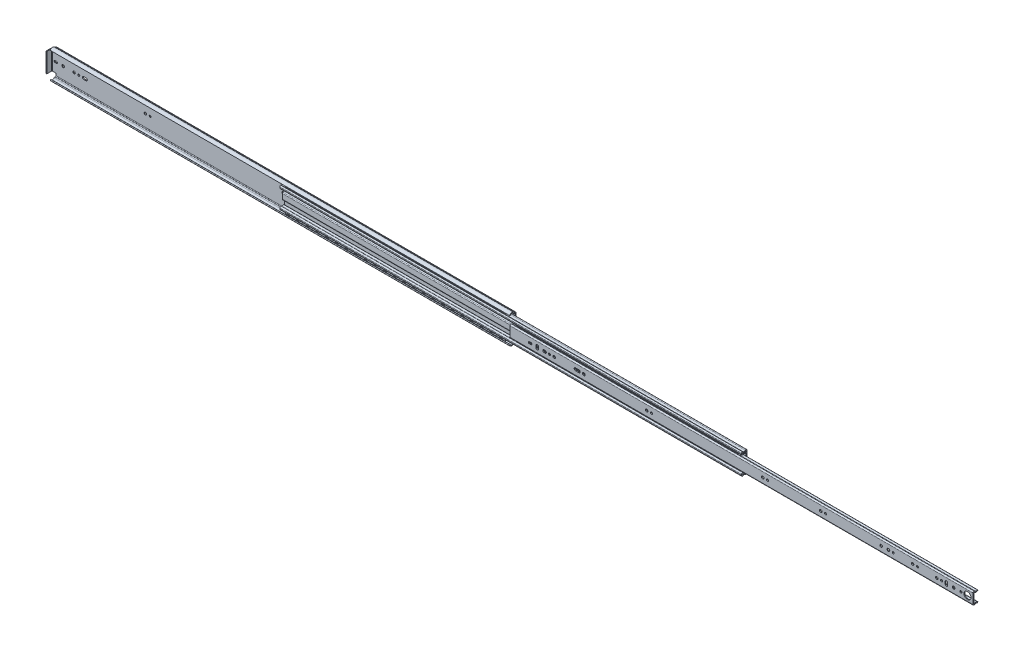
from build123d import *
from build123d.topology import SkipClean

# Parameters (mm, degrees)
EXTRUDE_THIN1_START     = -609.6
EXTRUDE_THIN1_DEPTH     = 1219.2
EXTRUDE_THIN2_DEPTH     = 1212.85
EXTRUDE_THIN5_START     = -1216.66
EXTRUDE_THIN5_DEPTH     = 1216.66
CUT_EXTRUDE1_DEPTH      = 1830.230661576
CUT_EXTRUDE1_DEPTH_BACK = 1830.230661576
SKETCH6_W               = 12.7
SKETCH6_H               = 12.7
SKETCH9_W               = 2.3622
SKETCH9_H               = 13.3858
EXTRUDE1_DEPTH          = 25.4
FILLET1_R               = 1.016
FILLET2_R               = 3.3782
CUT_EXTRUDE2_DEPTH      = 2.3622
SKETCH2_R               = 2.5781
SKETCH2_R_2             = 3.302
CUT_EXTRUDE12_DEPTH     = 2.3622
SKETCH22_R              = 2.5781
SKETCH22_R_2            = 3.302
SKETCH22_R_3            = 3.5687
CUT_EXTRUDE13_DEPTH     = 2.3622
SKETCH23_R              = 2.5781
SKETCH23_R_2            = 3.302
CUT_EXTRUDE14_DEPTH     = 2.3622
SKETCH24_R              = 2.5781
SKETCH24_R_2            = 3.302
CUT_EXTRUDE15_DEPTH     = 2.3622
SKETCH25_R              = 2.5781
SKETCH25_R_2            = 3.302
CUT_EXTRUDE16_DEPTH     = 2.3622
SKETCH27_R              = 3.5687
CUT_E_DEPTH             = 2.3622
SKETCH28_R              = 3.302
CUT_F_DEPTH             = 2.3622
SKETCH29_R              = 2.5781
CUT_EXTRUDE18_DEPTH     = 2.3622
CUT_H_DEPTH             = 2.3622
CUT_J_DEPTH             = 2.3622
SKETCH32_R              = 2.5781
SKETCH32_R_2            = 3.302
CUT_EXTRUDE21_DEPTH     = 2.3622
SKETCH210_R             = 2.5781
SKETCH210_R_2           = 3.302
CUT_EXTRUDE19_DEPTH     = 2.3622
SKETCH211_R             = 2.5781
SKETCH211_R_2           = 3.302
CUT_EXTRUDE110_DEPTH    = 2.3622
SKETCH212_R             = 2.5781
SKETCH212_R_2           = 3.302
CUT_EXTRUDE111_DEPTH    = 2.3622
SKETCH214_R             = 2.5781
SKETCH214_R_2           = 3.302
CUT_EXTRUDE113_DEPTH    = 2.3622
SKETCH215_R             = 3.302
CUT_EXTRUDE114_DEPTH    = 2.3622
CUT_R_DEPTH             = 2.3622
LPATTERN1_COUNT         = 23
LPATTERN1_PITCH         = 25.4
EXTRUDE2_DEPTH          = 12.7
EXTRUDE2_DEPTH_BACK     = 565.15
SKETCH218_W             = 11.43
SKETCH218_H             = 1.27
LPATTERN2_COUNT         = 23
LPATTERN2_PITCH         = 25.4
EXTRUDE3_DEPTH          = 12.7
EXTRUDE3_DEPTH_BACK     = 568.96
SKETCH220_W             = 9.245599771
SKETCH220_H             = 1.27


# Read off the part's stored shape, not the designer's step: Extrude-Thin1, Extrude-Thin5
with BuildPart() as part:
    # Extrude-Thin1 outline → Extrude-Thin1 (new body)
    with BuildSketch(Plane(origin=(0, 0, 0), x_dir=(0, 0, -1), z_dir=(1, 0, 0)).offset(EXTRUDE_THIN1_START)):
        with BuildLine():
            ThreePointArc((5.752462483, 35.334775085), (-0.647910774, 38.071449668), (-6.469678085, 34.255536805))
            Line((-6.469678085, 34.255536805), (-4.394919251, 33.126216382))
            ThreePointArc((-4.394919251, 33.126216382), (-0.440132491, 35.718405464), (3.907707273, 33.85935411))
            ThreePointArc((3.907707273, 33.85935411), (4.993998236, 32.994951487), (6.347544809, 32.686517335))
            Line((6.347544809, 32.686517335), (7.175193262, 32.686517335))
            ThreePointArc((7.175193262, 32.686517335), (8.297725277, 32.22154935), (8.762693262, 31.099017335))
            Line((8.762693262, 31.099017335), (8.762693262, 0))
            Line((8.762693262, 0), (11.124893262, 0))
            Line((11.124893262, 0), (11.124893262, 31.099017335))
            ThreePointArc((11.124893262, 31.099017335), (9.968052916, 33.891876989), (7.175193262, 35.048717335))
            Line((7.175193262, 35.048717335), (6.347544809, 35.048717335))
            ThreePointArc((6.347544809, 35.048717335), (6.017411498, 35.123945177), (5.752462483, 35.334775085))
        make_face()
    extrude(amount=EXTRUDE_THIN1_DEPTH)

    # Sketch6 → Cut-Extrude1 (cut, two sides: drawn at the far end of the back side and taken through both)
    with BuildSketch(Plane.XY.offset(-CUT_EXTRUDE1_DEPTH_BACK)):
        with Locations((-603.25, 31.75)):
            Rectangle(SKETCH6_W, SKETCH6_H)
    extrude(amount=CUT_EXTRUDE1_DEPTH + CUT_EXTRUDE1_DEPTH_BACK, mode=Mode.SUBTRACT)

    # Sketch9 → Extrude1 (add)
    with BuildSketch(Plane(origin=(0, 25.4, 0), x_dir=(-1, 0, 0), z_dir=(0, 1, 0))):
        with Locations((608.4189, -2.069793262)):
            Rectangle(SKETCH9_W, SKETCH9_H)
    extrude(amount=-EXTRUDE1_DEPTH)

    # Fillet1
    fillet1_edges = [part.edges().sort_by_distance(p)[0] for p in [
        (-607.2378, 12.7, -8.762693262),
    ]]
    fillet(fillet1_edges, radius=FILLET1_R)

    # Fillet2
    fillet2_edges = [part.edges().sort_by_distance(p)[0] for p in [
        (-609.6, 12.7, -11.124893262),
    ]]
    fillet(fillet2_edges, radius=FILLET2_R)

    # Sketch32 → Cut-Extrude21 (cut)
    with BuildSketch(Plane.XY.offset(-8.762693262)):
        with Locations((596.9, 0)):
            Circle(SKETCH32_R)
        with Locations((577.85, 0)):
            Circle(SKETCH32_R_2)
        with Locations((520.7, 0)):
            Circle(SKETCH32_R_2)
        with Locations((533.4, 0)):
            Circle(SKETCH32_R)
        with BuildLine():
            Line((549.148, 0), (561.848, 0))
            ThreePointArc((561.848, 0), (560.880866591, 2.334866591), (558.546, 3.302))
            Line((558.546, 3.302), (552.45, 3.302))
            ThreePointArc((552.45, 3.302), (550.115133409, 2.334866591), (549.148, 0))
        make_face()
    extrude(amount=-CUT_EXTRUDE21_DEPTH, mode=Mode.SUBTRACT)

    # Sketch210 → Cut-Extrude19 (cut)
    with BuildSketch(Plane(origin=(-677.249248887, 14.903736783, -8.762693262), x_dir=(1, 0, 0), z_dir=(0, 0, 1))):
        with Locations((1051.899248887, -14.903736783)):
            Circle(SKETCH210_R)
        with Locations((1039.199248887, -14.903736783)):
            Circle(SKETCH210_R_2)
    extrude(amount=-CUT_EXTRUDE19_DEPTH, mode=Mode.SUBTRACT)

    # Sketch211 → Cut-Extrude110 (cut)
    with BuildSketch(Plane(origin=(-447.985498291, 15.81613418, -8.762693262), x_dir=(1, 0, 0), z_dir=(0, 0, 1))):
        with Locations((460.685498291, -15.81613418)):
            Circle(SKETCH211_R)
        with Locations((447.985498291, -15.81613418)):
            Circle(SKETCH211_R_2)
    extrude(amount=-CUT_EXTRUDE110_DEPTH, mode=Mode.SUBTRACT)

    # Sketch212 → Cut-Extrude111 (cut)
    with BuildSketch(Plane(origin=(250.194594693, 14.477181682, -8.762693262), x_dir=(1, 0, 0), z_dir=(0, 0, 1))):
        with Locations((-599.444594693, -14.477181682)):
            Circle(SKETCH212_R)
        with Locations((-612.144594693, -14.477181682)):
            Circle(SKETCH212_R_2)
    extrude(amount=-CUT_EXTRUDE111_DEPTH, mode=Mode.SUBTRACT)

    # Sketch214 → Cut-Extrude113 (cut)
    with BuildSketch(Plane(origin=(529.798432462, 18.139402612, -8.762693262), x_dir=(1, 0, 0), z_dir=(0, 0, 1))):
        with Locations((-1066.500432462, -18.139402612)):
            Circle(SKETCH214_R)
        with Locations((-1079.200432462, -18.139402612)):
            Circle(SKETCH214_R_2)
        with BuildLine():
            Line((-1044.148432462, -18.139402612), (-1056.848432462, -18.139402612))
            ThreePointArc((-1056.848432462, -18.139402612), (-1055.881299054, -15.80453602), (-1053.546432462, -14.837402612))
            Line((-1053.546432462, -14.837402612), (-1047.450432462, -14.837402612))
            ThreePointArc((-1047.450432462, -14.837402612), (-1045.115565871, -15.80453602), (-1044.148432462, -18.139402612))
        make_face()
    extrude(amount=-CUT_EXTRUDE113_DEPTH, mode=Mode.SUBTRACT)

    # Sketch215 → Cut-Extrude114 (cut)
    with BuildSketch(Plane(origin=(674.3557152, 11.320285871, -8.762693262), x_dir=(1, 0, 0), z_dir=(0, 0, 1))):
        with Locations((-1252.2057152, -11.320285871)):
            Circle(SKETCH215_R)
    extrude(amount=-CUT_EXTRUDE114_DEPTH, mode=Mode.SUBTRACT)

    # Sketch216 → Cut R (cut)
    with BuildSketch(Plane.XY.offset(-8.762693262)):
        with BuildLine():
            Line((-601.6625, 0), (-592.1375, 0))
            ThreePointArc((-592.1375, 0), (-592.892608007, 1.822991993), (-594.7156, 2.5781))
            Line((-594.7156, 2.5781), (-599.0844, 2.5781))
            ThreePointArc((-599.0844, 2.5781), (-600.907391993, 1.822991993), (-601.6625, 0))
        make_face()
    extrude(amount=-CUT_R_DEPTH, mode=Mode.SUBTRACT)

    # Mirror1 3: part across plane


with BuildPart() as body_2:
    # Sketch4 → Extrude-Thin2 (new body)
    with BuildSketch(Plane(origin=(1219.2, 0, 0), x_dir=(0, 0, -1), z_dir=(1, 0, 0))):
        with BuildLine():
            ThreePointArc((3.54024831, 19.789205828), (0.77024158, 21.457292879), (-2.36668079, 20.672965307))
            ThreePointArc((-2.36668079, 20.672965307), (-3.091811244, 20.294053258), (-3.898522237, 20.157649845))
            ThreePointArc((-3.898522237, 20.157649845), (-5.766174756, 20.914093138), (-6.542172842, 22.773705828))
            Line((-6.542172842, 22.773705828), (-6.542172842, 25.161305828))
            ThreePointArc((-6.542172842, 25.161305828), (-5.766174756, 27.020918518), (-3.898522237, 27.77736181))
            ThreePointArc((-3.898522237, 27.77736181), (-3.659975019, 27.729624759), (-3.455361804, 27.598030559))
            ThreePointArc((-3.455361804, 27.598030559), (-0.023095262, 26.226172038), (3.414460302, 27.584723163))
            ThreePointArc((3.414460302, 27.584723163), (6.244879756, 28.080225918), (7.822893148, 25.678836527))
            Line((7.822893148, 25.678836527), (7.822893148, 11.408756936))
            ThreePointArc((7.822893148, 11.408756936), (7.431553352, 9.948256936), (6.362393148, 8.879096732))
            Line((6.362393148, 8.879096732), (3.123893148, 7.009347885))
            ThreePointArc((3.123893148, 7.009347885), (2.84498179, 6.730436527), (2.742893148, 6.349436527))
            Line((2.742893148, 6.349436527), (2.742893148, 0))
            Line((2.742893148, 0), (0.583893148, 0))
            Line((0.583893148, 0), (0.583893148, 6.349436527))
            ThreePointArc((0.583893148, 6.349436527), (0.975232943, 7.809936527), (2.044393148, 8.879096732))
            Line((2.044393148, 8.879096732), (5.282893148, 10.748845578))
            ThreePointArc((5.282893148, 10.748845578), (5.561804505, 11.027756936), (5.663893148, 11.408756936))
            Line((5.663893148, 11.408756936), (5.663893148, 25.678836527))
            ThreePointArc((5.663893148, 25.678836527), (5.388123817, 26.098496809), (4.893487408, 26.011904095))
            ThreePointArc((4.893487408, 26.011904095), (0.412345154, 24.079826794), (-4.266408016, 25.466487303))
            ThreePointArc((-4.266408016, 25.466487303), (-4.352985021, 25.324684037), (-4.383172842, 25.161305828))
            Line((-4.383172842, 25.161305828), (-4.383172842, 22.773705828))
            ThreePointArc((-4.383172842, 22.773705828), (-4.247561526, 22.448724969), (-3.921175649, 22.316530996))
            ThreePointArc((-3.921175649, 22.316530996), (-3.780197029, 22.340368486), (-3.653475202, 22.406586125))
            ThreePointArc((-3.653475202, 22.406586125), (1.089702598, 23.592527212), (5.278086268, 21.070299201))
            Line((5.278086268, 21.070299201), (3.54024831, 19.789205828))
        make_face()
    extrude(amount=-EXTRUDE_THIN2_DEPTH)

    # Mirror1: body 2 across plane


with BuildPart() as body_3:
    # Extrude-Thin5 outline → Extrude-Thin5 (new body)
    with BuildSketch(Plane(origin=(1828.8, 0, 0), x_dir=(0, 0, -1), z_dir=(1, 0, 0)).offset(EXTRUDE_THIN5_START)):
        with BuildLine():
            Line((-7.925106738, 0), (-5.562906738, 0))
            Line((-5.562906738, 0), (-5.562906738, 13.036209579))
            ThreePointArc((-5.562906738, 13.036209579), (-5.437890097, 13.255022954), (-5.185904431, 13.258440163))
            Line((-5.185904431, 13.258440163), (-2.932066495, 12.010964405))
            ThreePointArc((-2.932066495, 12.010964405), (1.369676528, 11.28348431), (5.180595526, 13.407423274))
            Line((5.180595526, 13.407423274), (3.41147618, 14.972736527))
            ThreePointArc((3.41147618, 14.972736527), (0.968956668, 13.611447462), (-1.788145038, 14.077708835))
            Line((-1.788145038, 14.077708835), (-4.041982973, 15.325184593))
            ThreePointArc((-4.041982973, 15.325184593), (-6.637435339, 15.28998734), (-7.925106738, 13.036209579))
            Line((-7.925106738, 13.036209579), (-7.925106738, 0))
        make_face()
    extrude(amount=EXTRUDE_THIN5_DEPTH)

    # Sketch10 → Cut-Extrude2 (cut)
    with BuildSketch(Plane.XY.offset(7.925106738)):
        with BuildLine():
            Line((1805.07005, 0), (1823.35805, 0))
            ThreePointArc((1823.35805, 0), (1814.21405, 9.144), (1805.07005, 0))
        make_face()
        with BuildLine():
            Line((1799.6281, 0), (1794.4719, 0))
            ThreePointArc((1794.4719, 0), (1797.05, 2.5781), (1799.6281, 0))
        make_face()
        with BuildLine():
            Line((1781.302, 0), (1774.698, 0))
            ThreePointArc((1774.698, 0), (1778, 3.302), (1781.302, 0))
        make_face()
        with BuildLine():
            Line((1762.252, 3.048), (1762.252, 0))
            Line((1762.252, 0), (1755.648, 0))
            Line((1755.648, 0), (1755.648, 3.048))
            ThreePointArc((1755.648, 3.048), (1758.95, 6.35), (1762.252, 3.048))
        make_face()
        with BuildLine():
            Line((1748.8281, 0), (1743.6719, 0))
            ThreePointArc((1743.6719, 0), (1746.25, 2.5781), (1748.8281, 0))
        make_face()
        with BuildLine():
            Line((1736.852, 0), (1730.248, 0))
            ThreePointArc((1730.248, 0), (1733.55, 3.302), (1736.852, 0))
        make_face()
    extrude(amount=-CUT_EXTRUDE2_DEPTH, mode=Mode.SUBTRACT)

    # Sketch2 → Cut-Extrude12 (cut)
    with BuildSketch(Plane(origin=(-2141.845428582, 6.157941778, 7.925106738), x_dir=(1, 0, 0), z_dir=(0, 0, 1))):
        with Locations((3824.595428582, -6.157941778)):
            Circle(SKETCH2_R)
        with Locations((3811.895428582, -6.157941778)):
            Circle(SKETCH2_R_2)
    extrude(amount=-CUT_EXTRUDE12_DEPTH, mode=Mode.SUBTRACT)

    # Sketch22 → Cut-Extrude13 (cut)
    with BuildSketch(Plane(origin=(-2143.135428603, 5.657950018, 7.925106738), x_dir=(1, 0, 0), z_dir=(0, 0, 1))):
        with Locations((3762.385428603, -5.657950018)):
            Circle(SKETCH22_R)
        with Locations((3730.635428603, -5.657950018)):
            Circle(SKETCH22_R_2)
        with Locations((3749.685428603, -5.657950018)):
            Circle(SKETCH22_R_3)
    extrude(amount=-CUT_EXTRUDE13_DEPTH, mode=Mode.SUBTRACT)

    # Sketch23 → Cut-Extrude14 (cut)
    with BuildSketch(Plane(origin=(-2022.429166167, 5.760053708, 7.925106738), x_dir=(1, 0, 0), z_dir=(0, 0, 1))):
        with Locations((3463.879166167, -5.760053708)):
            Circle(SKETCH23_R)
        with Locations((3451.179166167, -5.760053708)):
            Circle(SKETCH23_R_2)
    extrude(amount=-CUT_EXTRUDE14_DEPTH, mode=Mode.SUBTRACT)

    # Sketch24 → Cut-Extrude15 (cut)
    with BuildSketch(Plane(origin=(-1862.330020924, 7.905664942, 7.925106738), x_dir=(1, 0, 0), z_dir=(0, 0, 1))):
        with Locations((3151.380020924, -7.905664942)):
            Circle(SKETCH24_R)
        with Locations((3138.680020924, -7.905664942)):
            Circle(SKETCH24_R_2)
    extrude(amount=-CUT_EXTRUDE15_DEPTH, mode=Mode.SUBTRACT)

    # Sketch25 → Cut-Extrude16 (cut)
    with BuildSketch(Plane(origin=(-1718.369763818, 7.737387679, 7.925106738), x_dir=(1, 0, 0), z_dir=(0, 0, 1))):
        with Locations((2702.619763818, -7.737387679)):
            Circle(SKETCH25_R)
        with Locations((2689.919763818, -7.737387679)):
            Circle(SKETCH25_R_2)
    extrude(amount=-CUT_EXTRUDE16_DEPTH, mode=Mode.SUBTRACT)

    # Sketch27 → Cut E (cut)
    with BuildSketch(Plane.XY.offset(7.925106738)):
        with Locations((806.45, 0)):
            Circle(SKETCH27_R)
        with BuildLine():
            Line((796.8615, 0), (780.9865, 0))
            ThreePointArc((780.9865, 0), (781.953633409, 2.334866591), (784.2885, 3.302))
            Line((784.2885, 3.302), (793.5595, 3.302))
            ThreePointArc((793.5595, 3.302), (795.894366591, 2.334866591), (796.8615, 0))
        make_face()
    extrude(amount=-CUT_E_DEPTH, mode=Mode.SUBTRACT)

    # Sketch28 → Cut F (cut)
    with BuildSketch(Plane.XY.offset(7.925106738)):
        with Locations((728.726, 0)):
            Circle(SKETCH28_R)
    extrude(amount=-CUT_F_DEPTH, mode=Mode.SUBTRACT)

    # Sketch29 → Cut-Extrude18 (cut)
    with BuildSketch(Plane(origin=(-866.129297637, 5.417355799, 7.925106738), x_dir=(1, 0, 0), z_dir=(0, 0, 1))):
        with Locations((1582.155297637, -5.417355799)):
            Circle(SKETCH29_R)
        with BuildLine():
            Line((1574.217797637, -5.417355799), (1564.692797637, -5.417355799))
            ThreePointArc((1564.692797637, -5.417355799), (1565.659931046, -3.082489207), (1567.994797637, -2.115355799))
            Line((1567.994797637, -2.115355799), (1570.915797637, -2.115355799))
            ThreePointArc((1570.915797637, -2.115355799), (1573.250664228, -3.082489207), (1574.217797637, -5.417355799))
        make_face()
    extrude(amount=-CUT_EXTRUDE18_DEPTH, mode=Mode.SUBTRACT)

    # Sketch30 → Cut H (cut)
    with BuildSketch(Plane.XY.offset(7.925106738)):
        with BuildLine():
            Line((680.974, 0), (680.974, 3.048))
            ThreePointArc((680.974, 3.048), (684.276, 6.35), (687.578, 3.048))
            Line((687.578, 3.048), (687.578, 0))
            Line((687.578, 0), (680.974, 0))
        make_face()
    extrude(amount=-CUT_H_DEPTH, mode=Mode.SUBTRACT)

    # Sketch31 → Cut J (cut)
    with BuildSketch(Plane.XY.offset(7.925106738)):
        with BuildLine():
            Line((669.9885, 0), (660.4635, 0))
            ThreePointArc((660.4635, 0), (661.218608007, 1.822991993), (663.0416, 2.5781))
            Line((663.0416, 2.5781), (667.4104, 2.5781))
            ThreePointArc((667.4104, 2.5781), (669.233391993, 1.822991993), (669.9885, 0))
        make_face()
    extrude(amount=-CUT_J_DEPTH, mode=Mode.SUBTRACT)

    # Mirror1 2: body 3 across plane


with BuildPart() as body_2_1:
    add(body_2.part)
    add(body_2.part.mirror(Plane.ZX))


with BuildPart() as body_3_1:
    with SkipClean():  # the faces are left unmerged after this step: merging them gives an invalid solid
        add(body_3.part)
        add(body_3.part.mirror(Plane.ZX))


with BuildPart() as part_1:
    with SkipClean():  # the faces are left unmerged after this step: merging them gives an invalid solid
        add(part.part)
        add(part.part.mirror(Plane.ZX))


with BuildPart() as body_4:
    # Sketch217 → Revolve1 (revolve)
    with BuildSketch(Plane(origin=(584.2, 0, 0), x_dir=(0, 0, -1), z_dir=(1, 0, 0))):
        with BuildLine():
            Line((0, 35.7378), (0, 26.22652483))
            ThreePointArc((0, 26.22652483), (4.755637585, 30.982162415), (0, 35.7378))
        make_face()
    revolve(axis=Axis((584.2, 36.603094088, 0), (0, -1, 0)))


with BuildPart() as lpattern1_1:
    # LPattern1: pattern copy
    add(body_4.part.moved(Location(Vector(-1, 0, 0) * (1 * LPATTERN1_PITCH))))


with BuildPart() as lpattern1_2:
    # LPattern1: pattern copy
    add(body_4.part.moved(Location(Vector(-1, 0, 0) * (2 * LPATTERN1_PITCH))))


with BuildPart() as lpattern1_3:
    # LPattern1: pattern copy
    add(body_4.part.moved(Location(Vector(-1, 0, 0) * (3 * LPATTERN1_PITCH))))


with BuildPart() as lpattern1_4:
    # LPattern1: pattern copy
    add(body_4.part.moved(Location(Vector(-1, 0, 0) * (4 * LPATTERN1_PITCH))))


with BuildPart() as lpattern1_5:
    # LPattern1: pattern copy
    add(body_4.part.moved(Location(Vector(-1, 0, 0) * (5 * LPATTERN1_PITCH))))


with BuildPart() as lpattern1_6:
    # LPattern1: pattern copy
    add(body_4.part.moved(Location(Vector(-1, 0, 0) * (6 * LPATTERN1_PITCH))))


with BuildPart() as lpattern1_7:
    # LPattern1: pattern copy
    add(body_4.part.moved(Location(Vector(-1, 0, 0) * (7 * LPATTERN1_PITCH))))


with BuildPart() as lpattern1_8:
    # LPattern1: pattern copy
    add(body_4.part.moved(Location(Vector(-1, 0, 0) * (8 * LPATTERN1_PITCH))))


with BuildPart() as lpattern1_9:
    # LPattern1: pattern copy
    add(body_4.part.moved(Location(Vector(-1, 0, 0) * (9 * LPATTERN1_PITCH))))


with BuildPart() as lpattern1_10:
    # LPattern1: pattern copy
    add(body_4.part.moved(Location(Vector(-1, 0, 0) * (10 * LPATTERN1_PITCH))))


with BuildPart() as lpattern1_11:
    # LPattern1: pattern copy
    add(body_4.part.moved(Location(Vector(-1, 0, 0) * (11 * LPATTERN1_PITCH))))


with BuildPart() as lpattern1_12:
    # LPattern1: pattern copy
    add(body_4.part.moved(Location(Vector(-1, 0, 0) * (12 * LPATTERN1_PITCH))))


with BuildPart() as lpattern1_13:
    # LPattern1: pattern copy
    add(body_4.part.moved(Location(Vector(-1, 0, 0) * (13 * LPATTERN1_PITCH))))


with BuildPart() as lpattern1_14:
    # LPattern1: pattern copy
    add(body_4.part.moved(Location(Vector(-1, 0, 0) * (14 * LPATTERN1_PITCH))))


with BuildPart() as lpattern1_15:
    # LPattern1: pattern copy
    add(body_4.part.moved(Location(Vector(-1, 0, 0) * (15 * LPATTERN1_PITCH))))


with BuildPart() as lpattern1_16:
    # LPattern1: pattern copy
    add(body_4.part.moved(Location(Vector(-1, 0, 0) * (16 * LPATTERN1_PITCH))))


with BuildPart() as lpattern1_17:
    # LPattern1: pattern copy
    add(body_4.part.moved(Location(Vector(-1, 0, 0) * (17 * LPATTERN1_PITCH))))


with BuildPart() as lpattern1_18:
    # LPattern1: pattern copy
    add(body_4.part.moved(Location(Vector(-1, 0, 0) * (18 * LPATTERN1_PITCH))))


with BuildPart() as lpattern1_19:
    # LPattern1: pattern copy
    add(body_4.part.moved(Location(Vector(-1, 0, 0) * (19 * LPATTERN1_PITCH))))


with BuildPart() as lpattern1_20:
    # LPattern1: pattern copy
    add(body_4.part.moved(Location(Vector(-1, 0, 0) * (20 * LPATTERN1_PITCH))))


with BuildPart() as lpattern1_21:
    # LPattern1: pattern copy
    add(body_4.part.moved(Location(Vector(-1, 0, 0) * (21 * LPATTERN1_PITCH))))


with BuildPart() as lpattern1_22:
    # LPattern1: pattern copy
    add(body_4.part.moved(Location(Vector(-1, 0, 0) * (22 * LPATTERN1_PITCH))))


with BuildPart() as body_4_1:
    add(body_4.part)

    add(lpattern1_1.part)  # Extrude2 merges LPattern1_1

    add(lpattern1_2.part)  # Extrude2 merges LPattern1_2

    add(lpattern1_3.part)  # Extrude2 merges LPattern1_3

    add(lpattern1_4.part)  # Extrude2 merges LPattern1_4

    add(lpattern1_5.part)  # Extrude2 merges LPattern1_5

    add(lpattern1_6.part)  # Extrude2 merges LPattern1_6

    add(lpattern1_7.part)  # Extrude2 merges LPattern1_7

    add(lpattern1_8.part)  # Extrude2 merges LPattern1_8

    add(lpattern1_9.part)  # Extrude2 merges LPattern1_9

    add(lpattern1_10.part)  # Extrude2 merges LPattern1_10

    add(lpattern1_11.part)  # Extrude2 merges LPattern1_11

    add(lpattern1_12.part)  # Extrude2 merges LPattern1_12

    add(lpattern1_13.part)  # Extrude2 merges LPattern1_13

    add(lpattern1_14.part)  # Extrude2 merges LPattern1_14

    add(lpattern1_15.part)  # Extrude2 merges LPattern1_15

    add(lpattern1_16.part)  # Extrude2 merges LPattern1_16

    add(lpattern1_17.part)  # Extrude2 merges LPattern1_17

    add(lpattern1_18.part)  # Extrude2 merges LPattern1_18

    add(lpattern1_19.part)  # Extrude2 merges LPattern1_19

    add(lpattern1_20.part)  # Extrude2 merges LPattern1_20

    add(lpattern1_21.part)  # Extrude2 merges LPattern1_21

    add(lpattern1_22.part)  # Extrude2 merges LPattern1_22
    # Sketch218 → Extrude2 (add, two sides: drawn at the far end of the back side and taken through both)
    with BuildSketch(Plane(origin=(584.2, 0, 0), x_dir=(0, 0, -1), z_dir=(1, 0, 0)).offset(-EXTRUDE2_DEPTH_BACK)):
        with Locations((0, 30.9753)):
            Rectangle(SKETCH218_W, SKETCH218_H)
    extrude(amount=EXTRUDE2_DEPTH + EXTRUDE2_DEPTH_BACK)


with BuildPart() as body_5:
    # Sketch219 → Revolve2 (revolve)
    with BuildSketch(Plane(origin=(1193.8, 0, 0), x_dir=(0, 0, -1), z_dir=(1, 0, 0))):
        with BuildLine():
            Line((-0.000306852, 21.487836527), (-0.000306852, 13.550336527))
            ThreePointArc((-0.000306852, 13.550336527), (3.968443148, 17.519086527), (-0.000306852, 21.487836527))
        make_face()
    revolve(axis=Axis((1193.8, 22.284965157, 0.000306852), (0, -1, 0)))


with BuildPart() as lpattern2_1:
    # LPattern2: pattern copy
    add(body_5.part.moved(Location(Vector(-1, 0, 0) * (1 * LPATTERN2_PITCH))))


with BuildPart() as lpattern2_2:
    # LPattern2: pattern copy
    add(body_5.part.moved(Location(Vector(-1, 0, 0) * (2 * LPATTERN2_PITCH))))


with BuildPart() as lpattern2_3:
    # LPattern2: pattern copy
    add(body_5.part.moved(Location(Vector(-1, 0, 0) * (3 * LPATTERN2_PITCH))))


with BuildPart() as lpattern2_4:
    # LPattern2: pattern copy
    add(body_5.part.moved(Location(Vector(-1, 0, 0) * (4 * LPATTERN2_PITCH))))


with BuildPart() as lpattern2_5:
    # LPattern2: pattern copy
    add(body_5.part.moved(Location(Vector(-1, 0, 0) * (5 * LPATTERN2_PITCH))))


with BuildPart() as lpattern2_6:
    # LPattern2: pattern copy
    add(body_5.part.moved(Location(Vector(-1, 0, 0) * (6 * LPATTERN2_PITCH))))


with BuildPart() as lpattern2_7:
    # LPattern2: pattern copy
    add(body_5.part.moved(Location(Vector(-1, 0, 0) * (7 * LPATTERN2_PITCH))))


with BuildPart() as lpattern2_8:
    # LPattern2: pattern copy
    add(body_5.part.moved(Location(Vector(-1, 0, 0) * (8 * LPATTERN2_PITCH))))


with BuildPart() as lpattern2_9:
    # LPattern2: pattern copy
    add(body_5.part.moved(Location(Vector(-1, 0, 0) * (9 * LPATTERN2_PITCH))))


with BuildPart() as lpattern2_10:
    # LPattern2: pattern copy
    add(body_5.part.moved(Location(Vector(-1, 0, 0) * (10 * LPATTERN2_PITCH))))


with BuildPart() as lpattern2_11:
    # LPattern2: pattern copy
    add(body_5.part.moved(Location(Vector(-1, 0, 0) * (11 * LPATTERN2_PITCH))))


with BuildPart() as lpattern2_12:
    # LPattern2: pattern copy
    add(body_5.part.moved(Location(Vector(-1, 0, 0) * (12 * LPATTERN2_PITCH))))


with BuildPart() as lpattern2_13:
    # LPattern2: pattern copy
    add(body_5.part.moved(Location(Vector(-1, 0, 0) * (13 * LPATTERN2_PITCH))))


with BuildPart() as lpattern2_14:
    # LPattern2: pattern copy
    add(body_5.part.moved(Location(Vector(-1, 0, 0) * (14 * LPATTERN2_PITCH))))


with BuildPart() as lpattern2_15:
    # LPattern2: pattern copy
    add(body_5.part.moved(Location(Vector(-1, 0, 0) * (15 * LPATTERN2_PITCH))))


with BuildPart() as lpattern2_16:
    # LPattern2: pattern copy
    add(body_5.part.moved(Location(Vector(-1, 0, 0) * (16 * LPATTERN2_PITCH))))


with BuildPart() as lpattern2_17:
    # LPattern2: pattern copy
    add(body_5.part.moved(Location(Vector(-1, 0, 0) * (17 * LPATTERN2_PITCH))))


with BuildPart() as lpattern2_18:
    # LPattern2: pattern copy
    add(body_5.part.moved(Location(Vector(-1, 0, 0) * (18 * LPATTERN2_PITCH))))


with BuildPart() as lpattern2_19:
    # LPattern2: pattern copy
    add(body_5.part.moved(Location(Vector(-1, 0, 0) * (19 * LPATTERN2_PITCH))))


with BuildPart() as lpattern2_20:
    # LPattern2: pattern copy
    add(body_5.part.moved(Location(Vector(-1, 0, 0) * (20 * LPATTERN2_PITCH))))


with BuildPart() as lpattern2_21:
    # LPattern2: pattern copy
    add(body_5.part.moved(Location(Vector(-1, 0, 0) * (21 * LPATTERN2_PITCH))))


with BuildPart() as lpattern2_22:
    # LPattern2: pattern copy
    add(body_5.part.moved(Location(Vector(-1, 0, 0) * (22 * LPATTERN2_PITCH))))


with BuildPart() as body_5_1:
    add(body_5.part)

    add(lpattern2_1.part)  # Extrude3 merges LPattern2_1

    add(lpattern2_2.part)  # Extrude3 merges LPattern2_2

    add(lpattern2_3.part)  # Extrude3 merges LPattern2_3

    add(lpattern2_4.part)  # Extrude3 merges LPattern2_4

    add(lpattern2_5.part)  # Extrude3 merges LPattern2_5

    add(lpattern2_6.part)  # Extrude3 merges LPattern2_6

    add(lpattern2_7.part)  # Extrude3 merges LPattern2_7

    add(lpattern2_8.part)  # Extrude3 merges LPattern2_8

    add(lpattern2_9.part)  # Extrude3 merges LPattern2_9

    add(lpattern2_10.part)  # Extrude3 merges LPattern2_10

    add(lpattern2_11.part)  # Extrude3 merges LPattern2_11

    add(lpattern2_12.part)  # Extrude3 merges LPattern2_12

    add(lpattern2_13.part)  # Extrude3 merges LPattern2_13

    add(lpattern2_14.part)  # Extrude3 merges LPattern2_14

    add(lpattern2_15.part)  # Extrude3 merges LPattern2_15

    add(lpattern2_16.part)  # Extrude3 merges LPattern2_16

    add(lpattern2_17.part)  # Extrude3 merges LPattern2_17

    add(lpattern2_18.part)  # Extrude3 merges LPattern2_18

    add(lpattern2_19.part)  # Extrude3 merges LPattern2_19

    add(lpattern2_20.part)  # Extrude3 merges LPattern2_20

    add(lpattern2_21.part)  # Extrude3 merges LPattern2_21

    add(lpattern2_22.part)  # Extrude3 merges LPattern2_22
    # Sketch220 → Extrude3 (add, two sides: drawn at the far end of the back side and taken through both)
    with BuildSketch(Plane(origin=(1193.8, 0, 0), x_dir=(0, 0, -1), z_dir=(1, 0, 0)).offset(-EXTRUDE3_DEPTH_BACK)):
        with Locations((-0.000306853, 17.519086527)):
            Rectangle(SKETCH220_W, SKETCH220_H)
    extrude(amount=EXTRUDE3_DEPTH + EXTRUDE3_DEPTH_BACK)


with BuildPart() as body_6:
    # Mirror3: mirrored copy
    add(body_4_1.part.mirror(Plane.ZX))


with BuildPart() as body_7:
    # Mirror3 2: mirrored copy
    add(body_5_1.part.mirror(Plane.ZX))


solid = Compound([body_2_1.part, body_3_1.part, part_1.part, body_4_1.part, body_5_1.part, body_6.part, body_7.part])
